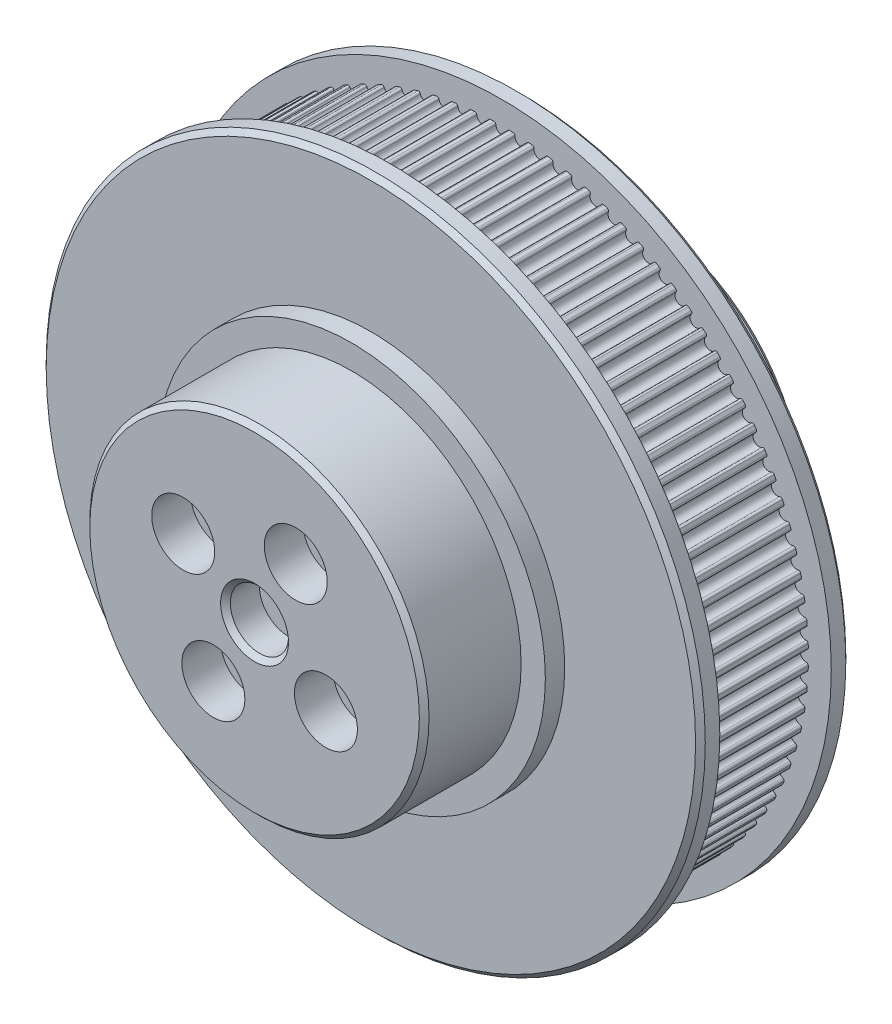
from build123d import *

# Parameters (mm, degrees)
SKETCHREVOLVEGEARBELT01_W       = 11.5
SKETCHREVOLVEGEARBELT01_H       = 31.640488143
TOOTHEXTRUDECUTGEARBELT01_DEPTH = 11.5
PATTERNGEARBELT01_COUNT         = 100
SKETCH_5_R                      = 34
EXTRUDE_1_DEPTH                 = 2
EXTRUDE_START                   = 2
SKETCH_20_R                     = 34
EXTRUDE_10_DEPTH                = 2
SKETCH_12_R                     = 20
EXTRUDE_5_DEPTH                 = 2
SKETCH_6_R                      = 20
EXTRUDE_6_DEPTH                 = 2
SKETCH_13_R                     = 17.5
EXTRUDE_7_DEPTH                 = 10
EXTRUDE_START_2                 = 10
SKETCH_14_R                     = 17.5
EXTRUDE_8_DEPTH                 = 10
SKETCH_15_R                     = 12.1
CUT_EXTRUDE_1_DEPTH             = 7
CUT_EXTRUDE_2_DEPTH             = 55.426556018
CUT_EXTRUDE_2_DEPTH_BACK        = 55.426556018
SKETCH_16_R                     = 1.75
SKETCH_17_R                     = 3.25
CUT_EXTRUDE_3_DEPTH             = 4
SKETCH_18_R                     = 3
CUT_EXTRUDE_4_DEPTH             = 3.5
CUT_EXTRUDE_5_DEPTH             = 55.426556018
CUT_EXTRUDE_5_DEPTH_BACK        = 55.426556018
SKETCH_19_R                     = 1
CHAMFER_1_SIZE                  = 0.5
FILLET_1_R                      = 0.4
CHAMFER_2_SIZE                  = 0.5
CHAMFER_3_SIZE                  = 0.5


with BuildPart() as part:
    # SketchRevolveGearBelt01 → GearBelt01 (revolve)
    with BuildSketch(Plane(origin=(0, 0, 0), x_dir=(0, 0, -1), z_dir=(1, 0, 0))):
        with Locations((5.75, 15.820244072)):
            Rectangle(SKETCHREVOLVEGEARBELT01_W, SKETCHREVOLVEGEARBELT01_H)
    revolve(axis=Axis((0, 0, 0), (0, 0, -1)))

    # SketchToothGearBelt01 → ToothExtrudeCutGearBelt01 (cut)
    with BuildSketch(Plane.XY):
        with BuildLine():
            Line((-0.813963777, 31.630016644), (0, 34.180488105))
            Line((0, 34.180488105), (0.813963777, 31.630016644))
            ThreePointArc((0.813963777, 31.630016644), (0.663006412, 31.570874086), (0.599999991, 31.421488146))
            ThreePointArc((0.599999991, 31.421488146), (0, 30.821488155), (-0.599999991, 31.421488146))
            ThreePointArc((-0.599999991, 31.421488146), (-0.663006412, 31.570874086), (-0.813963777, 31.630016644))
        make_face()
    toothextrudecutgearbelt01 = extrude(amount=-TOOTHEXTRUDECUTGEARBELT01_DEPTH, mode=Mode.SUBTRACT)

    # PatternGearBelt01: ToothExtrudeCutGearBelt01 ×100 about axis
    patterngearbelt01_axis = Axis((0, 0, 55), (0, 0, -1))
    for i in range(1, PATTERNGEARBELT01_COUNT):
        add(toothextrudecutgearbelt01.rotate(patterngearbelt01_axis, i * 360 / PATTERNGEARBELT01_COUNT), mode=Mode.SUBTRACT)

    # Эскиз5 → Бобышка-Вытянуть1 (add)
    with BuildSketch(Plane(origin=(0, 0, 0), x_dir=(-1, 0, 0), z_dir=(0, 0, -1))):
        Circle(SKETCH_5_R)
    extrude(amount=-EXTRUDE_1_DEPTH)

    # Эскиз20 → Бобышка-Вытянуть10 (add)
    with BuildSketch(Plane(origin=(0, 0, -11.5), x_dir=(-1, 0, 0), z_dir=(0, 0, -1)).offset(EXTRUDE_START)):
        Circle(SKETCH_20_R)
    extrude(amount=-EXTRUDE_10_DEPTH)

    # Эскиз12 → Бобышка-Вытянуть5 (add)
    with BuildSketch(Plane(origin=(0, 0, -13.5), x_dir=(-1, 0, 0), z_dir=(0, 0, -1))):
        Circle(SKETCH_12_R)
    extrude(amount=EXTRUDE_5_DEPTH)

    # Эскиз6 → Бобышка-Вытянуть6 (add)
    with BuildSketch(Plane.XY.offset(2).offset(EXTRUDE_START)):
        Circle(SKETCH_6_R)
    extrude(amount=-EXTRUDE_6_DEPTH)

    # Эскиз13 → Бобышка-Вытянуть7 (add)
    with BuildSketch(Plane.XY.offset(4)):
        Circle(SKETCH_13_R)
    extrude(amount=EXTRUDE_7_DEPTH)

    # Эскиз14 → Бобышка-Вытянуть8 (add)
    with BuildSketch(Plane(origin=(0, 0, -15.5), x_dir=(-1, 0, 0), z_dir=(0, 0, -1)).offset(EXTRUDE_START_2)):
        Circle(SKETCH_14_R)
    extrude(amount=-EXTRUDE_8_DEPTH)

    # Эскиз15 → Вырез-Вытянуть1 (cut)
    with BuildSketch(Plane(origin=(0, 0, -25.5), x_dir=(-1, 0, 0), z_dir=(0, 0, -1))):
        Circle(SKETCH_15_R)
    extrude(amount=-CUT_EXTRUDE_1_DEPTH, mode=Mode.SUBTRACT)

    # Эскиз16 → Вырез-Вытянуть2 (cut, two sides: drawn at the far end of the back side and taken through both)
    with BuildSketch(Plane.XY.offset(-CUT_EXTRUDE_2_DEPTH_BACK)):
        with Locations((4.25, 7.361215932)):
            Circle(SKETCH_16_R)
        with Locations((7.361215932, -4.25)):
            Circle(SKETCH_16_R)
        with Locations((-4.25, -7.361215932)):
            Circle(SKETCH_16_R)
        with Locations((-7.361215932, 4.25)):
            Circle(SKETCH_16_R)
    extrude(amount=CUT_EXTRUDE_2_DEPTH + CUT_EXTRUDE_2_DEPTH_BACK, mode=Mode.SUBTRACT)

    # Эскиз17 → Вырез-Вытянуть3 (cut)
    with BuildSketch(Plane.XY.offset(14)):
        with Locations((4.25, 7.361215932)):
            Circle(SKETCH_17_R)
        with Locations((7.361215932, -4.25)):
            Circle(SKETCH_17_R)
        with Locations((-4.25, -7.361215932)):
            Circle(SKETCH_17_R)
        with Locations((-7.361215932, 4.25)):
            Circle(SKETCH_17_R)
    extrude(amount=-CUT_EXTRUDE_3_DEPTH, mode=Mode.SUBTRACT)

    # Эскиз18 → Вырез-Вытянуть4 (cut)
    with BuildSketch(Plane.XY.offset(14)):
        Circle(SKETCH_18_R)
    extrude(amount=-CUT_EXTRUDE_4_DEPTH, mode=Mode.SUBTRACT)

    # Эскиз19 → Вырез-Вытянуть5 (cut, two sides: drawn at the far end of the back side and taken through both)
    with BuildSketch(Plane.XY.offset(-CUT_EXTRUDE_5_DEPTH_BACK)):
        Circle(SKETCH_19_R)
    extrude(amount=CUT_EXTRUDE_5_DEPTH + CUT_EXTRUDE_5_DEPTH_BACK, mode=Mode.SUBTRACT)

    # Фаска1
    chamfer_1_edges = [part.edges().sort_by_distance(p)[0] for p in [
        (12.1, 0, -25.5),
        (17.5, 0, -25.5),
        (-17.5, 0, 14),
    ]]
    chamfer(chamfer_1_edges, length=CHAMFER_1_SIZE)

    # Скругление1
    fillet_1_edges = [part.edges().sort_by_distance(p)[0] for p in [
        (12.1, 0, -18.5),
    ]]
    fillet(fillet_1_edges, radius=FILLET_1_R)

    # Фаска2
    chamfer_2_edges = [part.edges().sort_by_distance(p)[0] for p in [
        (-3, 0, 14),
    ]]
    chamfer(chamfer_2_edges, length=CHAMFER_2_SIZE)

    # Фаска3
    chamfer_3_edges = [part.edges().sort_by_distance(p)[0] for p in [
        (34, 0, -13.5),
        (34, 0, 2),
    ]]
    chamfer(chamfer_3_edges, length=CHAMFER_3_SIZE)


solid = part.part
